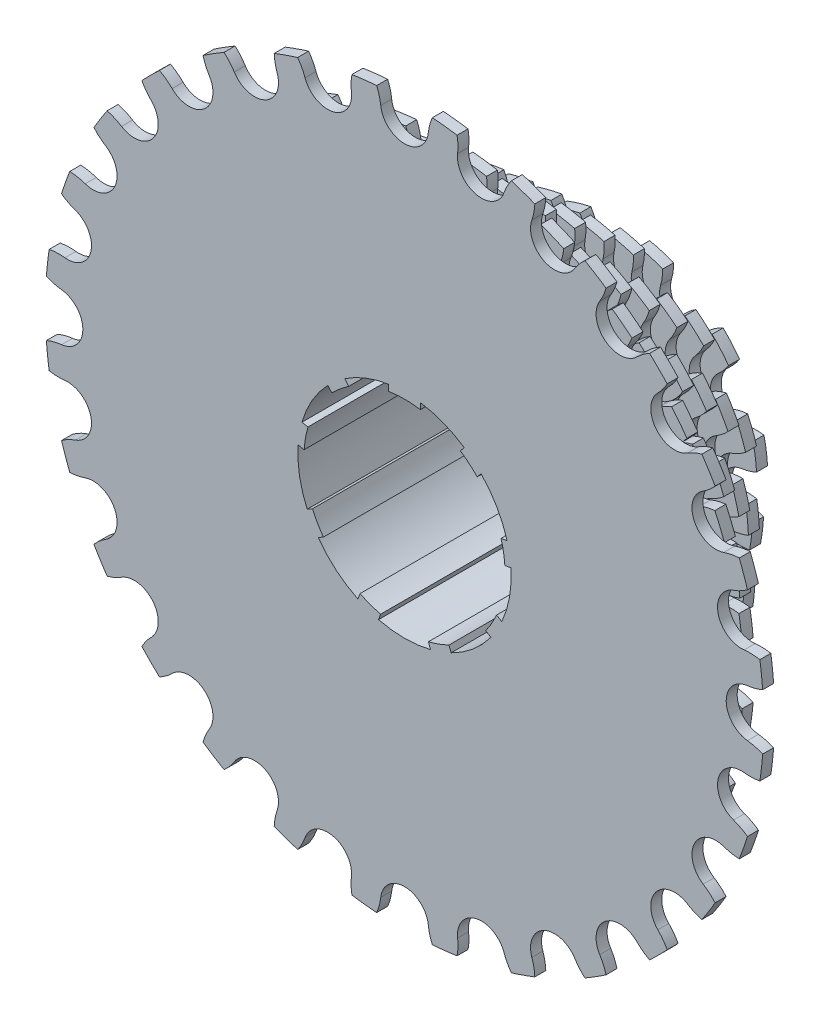
from build123d import *

# Parameters (mm, degrees)
SK_NUCLEO_R    = 18.5
NUCLEO_DEPTH   = 35.4
SK_DISCO_0_R   = 24.21046977
SK_DISCO_0_R_2 = 18.5
DISCO_0_DEPTH  = 1.8
HUECO_0_DEPTH  = 1.8
MATRIZ_0_COUNT = 11
SK_DISCO_1_R   = 28.347453866
SK_DISCO_1_R_2 = 18.5
DISCO_1_DEPTH  = 1.8
HUECO_1_DEPTH  = 1.8
MATRIZ_1_COUNT = 13
SK_DISCO_2_R   = 32.459479756
SK_DISCO_2_R_2 = 18.5
DISCO_2_DEPTH  = 1.8
HUECO_2_DEPTH  = 1.8
MATRIZ_2_COUNT = 15
SK_DISCO_3_R   = 36.555266755
SK_DISCO_3_R_2 = 18.5
DISCO_3_DEPTH  = 1.8
HUECO_3_DEPTH  = 1.8
MATRIZ_3_COUNT = 17
SK_DISCO_4_R   = 40.639902921
SK_DISCO_4_R_2 = 18.5
DISCO_4_DEPTH  = 1.8
HUECO_4_DEPTH  = 1.8
MATRIZ_4_COUNT = 19
SK_DISCO_5_R   = 44.716554464
SK_DISCO_5_R_2 = 18.5
DISCO_5_DEPTH  = 1.8
HUECO_5_DEPTH  = 1.8
MATRIZ_5_COUNT = 21
SK_DISCO_6_R   = 50.820906271
SK_DISCO_6_R_2 = 18.5
DISCO_6_DEPTH  = 1.8
HUECO_6_DEPTH  = 1.8
MATRIZ_6_COUNT = 24
SK_DISCO_7_R   = 58.946559974
SK_DISCO_7_R_2 = 18.5
DISCO_7_DEPTH  = 1.8
HUECO_7_DEPTH  = 1.8
MATRIZ_7_COUNT = 28


with BuildPart() as part:
    # Sk_Nucleo → Nucleo (new body)
    with BuildSketch(Plane.XY):
        Circle(SK_NUCLEO_R)
        with BuildLine():
            Line((2.6, 17.305779381), (2.6, 16.293863876))
            ThreePointArc((2.6, 16.293863876), (0, 16.5), (-2.6, 16.293863876))
            Line((-2.6, 16.293863876), (-2.6, 17.305779381))
            ThreePointArc((-2.6, 17.305779381), (-6.362648192, 16.302352836), (-9.810241185, 14.491693065))
            Line((-9.810241185, 14.491693065), (-9.163816615, 13.721314261))
            ThreePointArc((-9.163816615, 13.721314261), (-10.60599556, 12.639733311), (-11.92157661, 11.407278866))
            Line((-11.92157661, 11.407278866), (-12.56800118, 12.17765767))
            ThreePointArc((-12.56800118, 12.17765767), (-15.155444566, 8.75), (-16.830161491, 4.795379462))
            Line((-16.830161491, 4.795379462), (-15.839781591, 4.620748764))
            ThreePointArc((-15.839781591, 4.620748764), (-16.249327925, 2.865194932), (-16.464915031, 1.075440854))
            Line((-16.464915031, 1.075440854), (-17.455294931, 1.250071551))
            ThreePointArc((-17.455294931, 1.250071551), (-17.234135678, -3.038843109), (-15.975062189, -7.144745486))
            Line((-15.975062189, -7.144745486), (-15.104136721, -6.641916433))
            ThreePointArc((-15.104136721, -6.641916433), (-14.289419162, -8.25), (-13.304136721, -9.759607887))
            Line((-13.304136721, -9.759607887), (-14.175062189, -10.26243694))
            ThreePointArc((-14.175062189, -10.26243694), (-11.24878317, -13.405777755), (-7.645053746, -15.741764616))
            Line((-7.645053746, -15.741764616), (-7.301098416, -14.796755115))
            ThreePointArc((-7.301098416, -14.796755115), (-5.643332365, -15.504928243), (-3.918204981, -16.028027631))
            Line((-3.918204981, -16.028027631), (-4.262160311, -16.973037132))
            ThreePointArc((-4.262160311, -16.973037132), (0, -17.5), (4.262160311, -16.973037132))
            Line((4.262160311, -16.973037132), (3.918204981, -16.028027631))
            ThreePointArc((3.918204981, -16.028027631), (5.643332365, -15.504928243), (7.301098416, -14.796755115))
            Line((7.301098416, -14.796755115), (7.645053746, -15.741764616))
            ThreePointArc((7.645053746, -15.741764616), (11.24878317, -13.405777755), (14.175062189, -10.26243694))
            Line((14.175062189, -10.26243694), (13.304136721, -9.759607887))
            ThreePointArc((13.304136721, -9.759607887), (14.289419162, -8.25), (15.104136721, -6.641916433))
            Line((15.104136721, -6.641916433), (15.975062189, -7.144745486))
            ThreePointArc((15.975062189, -7.144745486), (17.234135678, -3.038843109), (17.455294931, 1.250071551))
            Line((17.455294931, 1.250071551), (16.464915031, 1.075440854))
            ThreePointArc((16.464915031, 1.075440854), (16.249327925, 2.865194932), (15.839781591, 4.620748764))
            Line((15.839781591, 4.620748764), (16.830161491, 4.795379462))
            ThreePointArc((16.830161491, 4.795379462), (15.155444566, 8.75), (12.56800118, 12.17765767))
            Line((12.56800118, 12.17765767), (11.92157661, 11.407278866))
            ThreePointArc((11.92157661, 11.407278866), (10.60599556, 12.639733311), (9.163816615, 13.721314261))
            Line((9.163816615, 13.721314261), (9.810241185, 14.491693065))
            ThreePointArc((9.810241185, 14.491693065), (6.362648192, 16.302352836), (2.6, 17.305779381))
        make_face(mode=Mode.SUBTRACT)
    extrude(amount=NUCLEO_DEPTH)

    # Sk_Disco_0 → Disco_0 (add)
    with BuildSketch(Plane.XY):
        Circle(SK_DISCO_0_R)
        Circle(SK_DISCO_0_R_2, mode=Mode.SUBTRACT)
    extrude(amount=DISCO_0_DEPTH)

    # Sk_Hueco_0 → Hueco_0 (cut)
    with BuildSketch(Plane.XY):
        with BuildLine():
            ThreePointArc((-3.768574584, 21.432552795), (0, 18.611433199), (3.768574584, 21.432552795))
            ThreePointArc((3.768574584, 21.432552795), (4.747923052, 23.612475296), (6.279262089, 25.447192246))
            ThreePointArc((6.279262089, 25.447192246), (0, 26.21046977), (-6.279262089, 25.447192246))
            ThreePointArc((-6.279262089, 25.447192246), (-4.747923052, 23.612475296), (-3.768574584, 21.432552795))
        make_face()
    hueco_0 = extrude(amount=HUECO_0_DEPTH, mode=Mode.SUBTRACT)

    # Matriz_0: Hueco_0 ×11 about axis
    matriz_0_axis = Axis((0, 0, -1.77), (0, 0, 1))
    for i in range(1, MATRIZ_0_COUNT):
        add(hueco_0.rotate(matriz_0_axis, i * 360 / MATRIZ_0_COUNT), mode=Mode.SUBTRACT)

    # Sk_Disco_1 → Disco_1 (add)
    with BuildSketch(Plane.XY.offset(4.8)):
        Circle(SK_DISCO_1_R)
        Circle(SK_DISCO_1_R_2, mode=Mode.SUBTRACT)
    extrude(amount=DISCO_1_DEPTH)

    # Sk_Hueco_1 → Hueco_1 (cut)
    with BuildSketch(Plane.XY.offset(4.8)):
        with BuildLine():
            ThreePointArc((-3.813541898, 25.59403867), (0, 22.606319392), (3.813541898, 25.59403867))
            ThreePointArc((3.813541898, 25.59403867), (4.697239992, 27.816722778), (6.148479231, 29.718077988))
            ThreePointArc((6.148479231, 29.718077988), (0, 30.347453866), (-6.148479231, 29.718077988))
            ThreePointArc((-6.148479231, 29.718077988), (-4.697239992, 27.816722778), (-3.813541898, 25.59403867))
        make_face()
    hueco_1 = extrude(amount=HUECO_1_DEPTH, mode=Mode.SUBTRACT)

    # Matriz_1: Hueco_1 ×13 about axis
    matriz_1_axis = Axis((0, 0, -1.77), (0, 0, 1))
    for i in range(1, MATRIZ_1_COUNT):
        add(hueco_1.rotate(matriz_1_axis, i * 360 / MATRIZ_1_COUNT), mode=Mode.SUBTRACT)

    # Sk_Disco_2 → Disco_2 (add)
    with BuildSketch(Plane.XY.offset(9.6)):
        Circle(SK_DISCO_2_R)
        Circle(SK_DISCO_2_R_2, mode=Mode.SUBTRACT)
    extrude(amount=DISCO_2_DEPTH)

    # Sk_Hueco_2 → Hueco_2 (cut)
    with BuildSketch(Plane.XY.offset(9.6)):
        with BuildLine():
            ThreePointArc((-3.841843858, 29.725203968), (0, 26.614140154), (3.841843858, 29.725203968))
            ThreePointArc((3.841843858, 29.725203968), (4.654353171, 31.976872948), (6.045298042, 33.925066199))
            ThreePointArc((6.045298042, 33.925066199), (0, 34.459479756), (-6.045298042, 33.925066199))
            ThreePointArc((-6.045298042, 33.925066199), (-4.654353171, 31.976872948), (-3.841843858, 29.725203968))
        make_face()
    hueco_2 = extrude(amount=HUECO_2_DEPTH, mode=Mode.SUBTRACT)

    # Matriz_2: Hueco_2 ×15 about axis
    matriz_2_axis = Axis((0, 0, -1.77), (0, 0, 1))
    for i in range(1, MATRIZ_2_COUNT):
        add(hueco_2.rotate(matriz_2_axis, i * 360 / MATRIZ_2_COUNT), mode=Mode.SUBTRACT)

    # Sk_Disco_3 → Disco_3 (add)
    with BuildSketch(Plane.XY.offset(14.4)):
        Circle(SK_DISCO_3_R)
        Circle(SK_DISCO_3_R_2, mode=Mode.SUBTRACT)
    extrude(amount=DISCO_3_DEPTH)

    # Sk_Hueco_3 → Hueco_3 (cut)
    with BuildSketch(Plane.XY.offset(14.4)):
        with BuildLine():
            ThreePointArc((-3.860796839, 33.836205806), (0, 30.630240879), (3.860796839, 33.836205806))
            ThreePointArc((3.860796839, 33.836205806), (4.618295452, 36.108650133), (5.962257069, 38.091469979))
            ThreePointArc((5.962257069, 38.091469979), (0, 38.555266755), (-5.962257069, 38.091469979))
            ThreePointArc((-5.962257069, 38.091469979), (-4.618295452, 36.108650133), (-3.860796839, 33.836205806))
        make_face()
    hueco_3 = extrude(amount=HUECO_3_DEPTH, mode=Mode.SUBTRACT)

    # Matriz_3: Hueco_3 ×17 about axis
    matriz_3_axis = Axis((0, 0, -1.77), (0, 0, 1))
    for i in range(1, MATRIZ_3_COUNT):
        add(hueco_3.rotate(matriz_3_axis, i * 360 / MATRIZ_3_COUNT), mode=Mode.SUBTRACT)

    # Sk_Disco_4 → Disco_4 (add)
    with BuildSketch(Plane.XY.offset(19.2)):
        Circle(SK_DISCO_4_R)
        Circle(SK_DISCO_4_R_2, mode=Mode.SUBTRACT)
    extrude(amount=DISCO_4_DEPTH)

    # Sk_Hueco_4 → Hueco_4 (cut)
    with BuildSketch(Plane.XY.offset(19.2)):
        with BuildLine():
            ThreePointArc((-3.874104595, 37.933166046), (0, 34.651966828), (3.874104595, 37.933166046))
            ThreePointArc((3.874104595, 37.933166046), (4.587836101, 40.221145391), (5.894176032, 42.230557775))
            ThreePointArc((5.894176032, 42.230557775), (0, 42.639902921), (-5.894176032, 42.230557775))
            ThreePointArc((-5.894176032, 42.230557775), (-4.587836101, 40.221145391), (-3.874104595, 37.933166046))
        make_face()
    hueco_4 = extrude(amount=HUECO_4_DEPTH, mode=Mode.SUBTRACT)

    # Matriz_4: Hueco_4 ×19 about axis
    matriz_4_axis = Axis((0, 0, -1.77), (0, 0, 1))
    for i in range(1, MATRIZ_4_COUNT):
        add(hueco_4.rotate(matriz_4_axis, i * 360 / MATRIZ_4_COUNT), mode=Mode.SUBTRACT)

    # Sk_Disco_5 → Disco_5 (add)
    with BuildSketch(Plane.XY.offset(24)):
        Circle(SK_DISCO_5_R)
        Circle(SK_DISCO_5_R_2, mode=Mode.SUBTRACT)
    extrude(amount=DISCO_5_DEPTH)

    # Sk_Hueco_5 → Hueco_5 (cut)
    with BuildSketch(Plane.XY.offset(24)):
        with BuildLine():
            ThreePointArc((-3.883804073, 42.019974713), (0, 38.677691053), (3.883804073, 42.019974713))
            ThreePointArc((3.883804073, 42.019974713), (4.561893836, 44.319961978), (5.837439555, 46.350412732))
            ThreePointArc((5.837439555, 46.350412732), (0, 46.716554464), (-5.837439555, 46.350412732))
            ThreePointArc((-5.837439555, 46.350412732), (-4.561893836, 44.319961978), (-3.883804073, 42.019974713))
        make_face()
    hueco_5 = extrude(amount=HUECO_5_DEPTH, mode=Mode.SUBTRACT)

    # Matriz_5: Hueco_5 ×21 about axis
    matriz_5_axis = Axis((0, 0, -1.77), (0, 0, 1))
    for i in range(1, MATRIZ_5_COUNT):
        add(hueco_5.rotate(matriz_5_axis, i * 360 / MATRIZ_5_COUNT), mode=Mode.SUBTRACT)

    # Sk_Disco_6 → Disco_6 (add)
    with BuildSketch(Plane.XY.offset(28.8)):
        Circle(SK_DISCO_6_R)
        Circle(SK_DISCO_6_R_2, mode=Mode.SUBTRACT)
    extrude(amount=DISCO_6_DEPTH)

    # Sk_Hueco_6 → Hueco_6 (cut)
    with BuildSketch(Plane.XY.offset(28.8)):
        with BuildLine():
            ThreePointArc((-3.894071148, 48.136575412), (0, 44.72156667), (3.894071148, 48.136575412))
            ThreePointArc((3.894071148, 48.136575412), (4.529598609, 50.450153622), (5.768187049, 52.505010785))
            ThreePointArc((5.768187049, 52.505010785), (0, 52.820906271), (-5.768187049, 52.505010785))
            ThreePointArc((-5.768187049, 52.505010785), (-4.529598609, 50.450153622), (-3.894071148, 48.136575412))
        make_face()
    hueco_6 = extrude(amount=HUECO_6_DEPTH, mode=Mode.SUBTRACT)

    # Matriz_6: Hueco_6 ×24 about axis
    matriz_6_axis = Axis((0, 0, -1.77), (0, 0, 1))
    for i in range(1, MATRIZ_6_COUNT):
        add(hueco_6.rotate(matriz_6_axis, i * 360 / MATRIZ_6_COUNT), mode=Mode.SUBTRACT)

    # Sk_Disco_7 → Disco_7 (add)
    with BuildSketch(Plane.XY.offset(33.6)):
        Circle(SK_DISCO_7_R)
        Circle(SK_DISCO_7_R_2, mode=Mode.SUBTRACT)
    extrude(amount=DISCO_7_DEPTH)

    # Sk_Hueco_7 → Hueco_7 (cut)
    with BuildSketch(Plane.XY.offset(33.6)):
        with BuildLine():
            ThreePointArc((-3.902976552, 56.274657274), (0, 52.786744182), (3.902976552, 56.274657274))
            ThreePointArc((3.902976552, 56.274657274), (4.495692332, 58.601091839), (5.696905972, 60.67972013))
            ThreePointArc((5.696905972, 60.67972013), (0, 60.946559974), (-5.696905972, 60.67972013))
            ThreePointArc((-5.696905972, 60.67972013), (-4.495692332, 58.601091839), (-3.902976552, 56.274657274))
        make_face()
    hueco_7 = extrude(amount=HUECO_7_DEPTH, mode=Mode.SUBTRACT)

    # Matriz_7: Hueco_7 ×28 about axis
    matriz_7_axis = Axis((0, 0, -1.77), (0, 0, 1))
    for i in range(1, MATRIZ_7_COUNT):
        add(hueco_7.rotate(matriz_7_axis, i * 360 / MATRIZ_7_COUNT), mode=Mode.SUBTRACT)


solid = part.part
